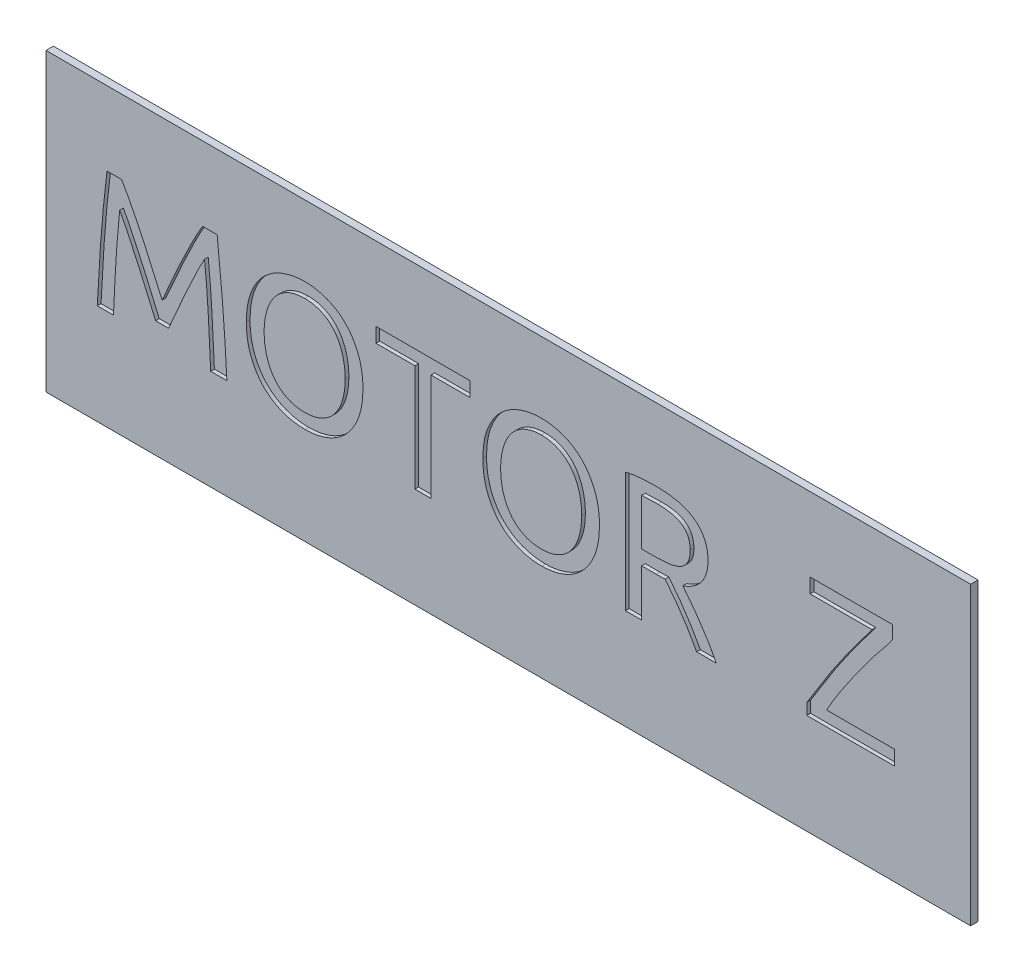
from build123d import *

# Parameters (mm, degrees)
SKETCH1_W           = 25
SKETCH1_H           = 8
BOSS_EXTRUDE1_DEPTH = 0.1
CUT_EXTRUDE7_DEPTH  = 0.1


with BuildPart() as part:
    # Sketch1 → Boss-Extrude1 (new, symmetric)
    with BuildSketch(Plane.XY):
        Rectangle(SKETCH1_W, SKETCH1_H)
    extrude(amount=BOSS_EXTRUDE1_DEPTH, both=True)

    # Sketch9 → Cut-Extrude7 (cut)
    # profile 1 of 6: a face of its own
    with BuildSketch(Plane.XY.offset(0.1)):
        with BuildLine():
            add(Edge.make_bspline(
                [(-9.536229427, -0.848692654), (-9.544634506, -0.828146196), (-9.562600754, -0.784227187), (-9.591985042, -0.714624734), (-9.625492372, -0.637272261), (-9.677233371, -0.521864454), (-9.744504025, -0.364753864), (-9.832482152, -0.166977322), (-9.92296909, 0.042467289), (-10.021780308, 0.254487234), (-10.119578899, 0.464076766), (-10.198456156, 0.633724123), (-10.2570802, 0.763035015), (-10.300618257, 0.852277183), (-10.341354489, 0.937076707), (-10.381804709, 1.015290731), (-10.418106083, 1.08748783), (-10.451534598, 1.150854179), (-10.481216875, 1.205242781), (-10.499607047, 1.238472947), (-10.508061649, 1.253750012)],
                knots=[0, 0, 0, 0, 0.517376005, 1.105915269, 1.760773085, 2.482005002, 4.053536049, 5.743800335, 7.526919201, 9.370646845, 11.19507727, 12.917374885, 13.730991583, 14.503857175, 15.231488722, 15.923435145, 16.555938939, 17.114840553, 17.593061379, 18, 18, 18, 18], degree=3))
            add(Edge.make_bspline(
                [(-10.508061649, 1.253750012), (-10.517836551, 1.1581829), (-10.537795761, 0.963046004), (-10.56460179, 0.664446106), (-10.587458205, 0.353874128), (-10.615737694, -0.076080232), (-10.645384376, -0.624296283), (-10.665130549, -1.065171889), (-10.675052538, -1.286701543)],
                knots=[0, 0, 0, 0, 0.679077711, 1.386597478, 2.119173185, 2.880364868, 4.432456496, 6, 6, 6, 6], degree=3))
            Line((-10.675052538, -1.286701543), (-11.113061427, -1.286701543))
            add(Edge.make_bspline(
                [(-11.113061427, -1.286701543), (-11.105846661, -1.143888281), (-11.091357823, -0.857087801), (-11.068063415, -0.426747336), (-11.039884562, 0.001677469), (-11.008699843, 0.424215727), (-10.973365724, 0.837754975), (-10.942920592, 1.175863444), (-10.916541513, 1.439558233), (-10.89504301, 1.630680777), (-10.873407518, 1.816414483), (-10.857888638, 1.938379771), (-10.850256094, 1.998365123)],
                knots=[0, 0, 0, 0, 1.301379718, 2.613457066, 3.922139659, 5.208762479, 6.46930065, 7.69936116, 8.298256288, 8.881072521, 9.449685557, 10, 10, 10, 10], degree=3))
            Line((-10.850256094, 1.998365123), (-10.456048094, 1.998365123))
            add(Edge.make_bspline(
                [(-10.456048094, 1.998365123), (-10.434443, 1.962186174), (-10.389479226, 1.886891796), (-10.32290253, 1.768078565), (-10.253693047, 1.639775853), (-10.157174908, 1.454764462), (-10.035148563, 1.210829097), (-9.890907706, 0.908338194), (-9.747688832, 0.599707058), (-9.633186619, 0.340946529), (-9.545048714, 0.137473174), (-9.480100574, -0.007045888), (-9.420435846, -0.145839811), (-9.380508701, -0.235520537), (-9.361025871, -0.279281099)],
                knots=[0, 0, 0, 0, 0.59986763, 1.248423783, 1.938655727, 2.675136447, 4.219033946, 5.821264257, 7.445793554, 9.062555474, 9.849353322, 10.602501462, 11.318077322, 12, 12, 12, 12], degree=3))
            add(Edge.make_bspline(
                [(-9.361025871, -0.279281099), (-9.34161754, -0.235487859), (-9.301805976, -0.145656468), (-9.240932219, -0.007393433), (-9.177222037, 0.137670038), (-9.088782171, 0.341012337), (-8.97337299, 0.599361197), (-8.831354593, 0.908539946), (-8.68683726, 1.210798855), (-8.564884499, 1.454767978), (-8.46835739, 1.639775254), (-8.39914953, 1.76807871), (-8.332572447, 1.886891763), (-8.28760872, 1.962186164), (-8.266003649, 1.998365123)],
                knots=[0, 0, 0, 0, 0.681925378, 1.39880734, 2.15064792, 2.937448884, 4.55553772, 6.178712694, 7.780949348, 9.324852961, 10.061336597, 10.751571274, 11.400129995, 12, 12, 12, 12], degree=3))
            Line((-8.266003649, 1.998365123), (-7.871795649, 1.998365123))
            add(Edge.make_bspline(
                [(-7.871795649, 1.998365123), (-7.843560988, 1.731537202), (-7.786649996, 1.19370741), (-7.716444512, 0.379099337), (-7.655476094, -0.449049157), (-7.624565254, -1.006048306), (-7.608990316, -1.286701543)],
                knots=[0, 0, 0, 0, 0.976863678, 1.969008288, 2.976651223, 4, 4, 4, 4], degree=3))
            Line((-7.608990316, -1.286701543), (-8.046999205, -1.286701543))
            add(Edge.make_bspline(
                [(-8.046999205, -1.286701543), (-8.056841874, -1.065166427), (-8.076430189, -0.62427995), (-8.107052119, -0.076145834), (-8.133354769, 0.353947245), (-8.15804529, 0.664359554), (-8.183098502, 0.963132456), (-8.203833148, 1.158196934), (-8.213990094, 1.253750012)],
                knots=[0, 0, 0, 0, 1.567533194, 3.119614613, 3.880697082, 4.61339043, 5.32076402, 6, 6, 6, 6], degree=3))
            add(Edge.make_bspline(
                [(-8.213990094, 1.253750012), (-8.222441922, 1.238471527), (-8.240826061, 1.205238271), (-8.270562721, 1.150877519), (-8.303780327, 1.087285968), (-8.341242626, 1.015681602), (-8.380452545, 0.9368381), (-8.421561881, 0.852340199), (-8.464797458, 0.762847465), (-8.524770688, 0.634163215), (-8.602075337, 0.463788101), (-8.700473372, 0.25457875), (-8.798771229, 0.042228836), (-8.890738682, -0.166563596), (-8.97693876, -0.365220651), (-9.04603685, -0.521429833), (-9.096406201, -0.637439812), (-9.130109986, -0.714605718), (-9.159442103, -0.784231091), (-9.177414404, -0.828147441), (-9.185822316, -0.848692654)],
                knots=[0, 0, 0, 0, 0.406937411, 0.885156816, 1.44405677, 2.078989805, 2.768540071, 3.496169455, 4.269032751, 5.084884979, 6.80495202, 8.629377023, 10.473099188, 12.25835962, 13.946485164, 15.520141682, 16.239232148, 16.894088018, 17.482625532, 18, 18, 18, 18], degree=3))
            Line((-9.185822316, -0.848692654), (-9.536229427, -0.848692654))
        make_face()
    # profile 2 of 6: a face of its own
    with BuildSketch(Plane.XY.offset(0.1)):
        with BuildLine():
            add(Edge.make_bspline(
                [(-7.083379649, 0.35583179), (-7.083011897, 0.390746436), (-7.082285424, 0.45971835), (-7.075730256, 0.561512543), (-7.066517975, 0.660201509), (-7.052707115, 0.755651788), (-7.035112001, 0.847972821), (-7.013018738, 0.936950646), (-6.98782377, 1.022948541), (-6.948889088, 1.132196439), (-6.891703894, 1.260917551), (-6.811648559, 1.404183591), (-6.720116984, 1.533997609), (-6.617215008, 1.650110873), (-6.503547702, 1.752249964), (-6.38155852, 1.842043482), (-6.249603257, 1.916746299), (-6.109964172, 1.978421801), (-5.963244128, 2.025891905), (-5.811771602, 2.061106688), (-5.655648602, 2.082066644), (-5.550182896, 2.084658887), (-5.496966205, 2.085966901)],
                knots=[0, 0, 0, 0, 0.792570647, 1.565678649, 2.315000585, 3.042323967, 3.754365743, 4.447760496, 5.122927003, 5.788006273, 7.079540449, 8.315548746, 9.508262372, 10.678590765, 11.830029448, 12.971618296, 14.110595966, 15.26540766, 16.431545614, 17.60623219, 18.792134379, 20, 20, 20, 20], degree=3))
            add(Edge.make_bspline(
                [(-5.496966205, 2.085966901), (-5.444432174, 2.084668494), (-5.340552633, 2.082101053), (-5.186928069, 2.061101455), (-5.038181188, 2.02589764), (-4.893999699, 1.978299714), (-4.75649071, 1.916542045), (-4.626080546, 1.842253951), (-4.506065786, 1.751960585), (-4.393693829, 1.650154454), (-4.292392792, 1.533525714), (-4.200618876, 1.404415327), (-4.121432489, 1.260850985), (-4.064810252, 1.132118459), (-4.026140495, 1.022825964), (-3.999862162, 0.937083034), (-3.978047432, 0.847953669), (-3.96037041, 0.755657096), (-3.946582283, 0.660200028), (-3.937363657, 0.561512956), (-3.930810236, 0.459718242), (-3.930083523, 0.390746399), (-3.929715649, 0.35583179)],
                knots=[0, 0, 0, 0, 1.200098081, 2.373045331, 3.535064534, 4.688987579, 5.837020001, 6.974362863, 8.110785483, 9.261997156, 10.43304313, 11.633514769, 12.875015323, 14.172847705, 14.842252987, 15.523309022, 16.221213965, 16.93788722, 17.669941481, 18.424137386, 19.202274073, 20, 20, 20, 20], degree=3))
            add(Edge.make_bspline(
                [(-3.929715649, 0.35583179), (-3.930083485, 0.32091717), (-3.930810123, 0.251945305), (-3.937364088, 0.150150752), (-3.946580741, 0.051463094), (-3.960375937, -0.043991874), (-3.978027489, -0.136296013), (-3.9999859, -0.225610319), (-4.026013951, -0.311655807), (-4.064726976, -0.420952939), (-4.12161308, -0.549334492), (-4.200599281, -0.692759867), (-4.292395693, -0.821863778), (-4.393700782, -0.938476979), (-4.506035857, -1.040349745), (-4.626283645, -1.130464317), (-4.756274512, -1.205718539), (-4.89404349, -1.267207357), (-5.038069009, -1.315152517), (-5.187036831, -1.349203779), (-5.340537828, -1.370499649), (-5.444427201, -1.373025796), (-5.496966205, -1.374303321)],
                knots=[0, 0, 0, 0, 0.797660173, 1.57573272, 2.329866459, 3.061860379, 3.778474561, 4.476321977, 5.162310661, 5.831660765, 7.124614354, 8.366012575, 9.566385262, 10.73733471, 11.888451492, 13.024780439, 14.164642593, 15.312580385, 16.466408316, 17.627150272, 18.800000839, 20, 20, 20, 20], degree=3))
            add(Edge.make_bspline(
                [(-5.496966205, -1.374303321), (-5.550187762, -1.373016106), (-5.655663113, -1.370465084), (-5.811664559, -1.349208113), (-5.963354698, -1.315147956), (-6.109920528, -1.267328839), (-6.2498187, -1.205925396), (-6.381355931, -1.130251058), (-6.503577167, -1.040639203), (-6.617209048, -0.938433741), (-6.720110567, -0.822334301), (-6.811681499, -0.692533294), (-6.891469652, -0.549379712), (-6.961428082, -0.393744201), (-7.015655118, -0.224054275), (-7.055449307, -0.041965776), (-7.078627009, 0.152884316), (-7.081764797, 0.286874292), (-7.083379649, 0.35583179)],
                knots=[0, 0, 0, 0, 0.966294476, 1.915018171, 2.853846361, 3.786758636, 4.710609883, 5.623854635, 6.537127584, 7.458280418, 8.39454505, 9.348717906, 10.33752657, 11.366969081, 12.442722914, 13.566707643, 14.747714126, 16, 16, 16, 16], degree=3))
        make_face()
        with BuildLine():
            add(Edge.make_bspline(
                [(-6.601569871, 0.35583179), (-6.600687434, 0.306291997), (-6.598959344, 0.209277484), (-6.58435282, 0.067435613), (-6.560497796, -0.06757804), (-6.52714936, -0.195322759), (-6.484972211, -0.31515596), (-6.434238344, -0.425763365), (-6.375841597, -0.527228262), (-6.30958327, -0.61940614), (-6.234366945, -0.701545918), (-6.151141077, -0.773402993), (-6.060937562, -0.83654569), (-5.962556004, -0.888632829), (-5.856901483, -0.929677345), (-5.744684456, -0.959253532), (-5.626157695, -0.976367967), (-5.545156639, -0.978835687), (-5.503810094, -0.980095321)],
                knots=[0, 0, 0, 0, 1.219915151, 2.388977954, 3.50768494, 4.593874435, 5.637052367, 6.63265979, 7.586765503, 8.516249197, 9.422985944, 10.323153062, 11.219383466, 12.129300506, 13.057951657, 14.005149726, 14.981739616, 16, 16, 16, 16], degree=3))
            add(Edge.make_bspline(
                [(-5.503810094, -0.980095321), (-5.462463404, -0.978841305), (-5.381687831, -0.976391439), (-5.263822077, -0.959331415), (-5.152736215, -0.929691503), (-5.048309556, -0.888464802), (-4.950756451, -0.836557457), (-4.861274892, -0.773368898), (-4.778633249, -0.701582899), (-4.704290373, -0.618965129), (-4.637124481, -0.527492397), (-4.578912531, -0.42572156), (-4.528107143, -0.315167953), (-4.485950489, -0.195319336), (-4.452596223, -0.067579003), (-4.428742841, 0.067435886), (-4.414135858, 0.209277411), (-4.412407832, 0.306291972), (-4.411525427, 0.35583179)],
                knots=[0, 0, 0, 0, 1.020887007, 1.994421647, 2.933173523, 3.853731272, 4.761024907, 5.65494637, 6.553188372, 7.458468617, 8.393664282, 9.35023113, 10.348406742, 11.394275573, 12.483266916, 13.604859629, 14.776938053, 16, 16, 16, 16], degree=3))
            add(Edge.make_bspline(
                [(-4.411525427, 0.35583179), (-4.412407805, 0.405371629), (-4.414135777, 0.502386231), (-4.428743142, 0.644227466), (-4.45259516, 0.77924339), (-4.48595427, 0.906980046), (-4.528093897, 1.026841588), (-4.578958705, 1.137350092), (-4.636870275, 1.239119584), (-4.704748511, 1.330030333), (-4.778390898, 1.413214951), (-4.861093503, 1.485090211), (-4.950982083, 1.547424335), (-5.048264275, 1.599547234), (-5.152861656, 1.640451554), (-5.263696011, 1.671229269), (-5.381705795, 1.687989934), (-5.462469486, 1.69048285), (-5.503810094, 1.691758901)],
                knots=[0, 0, 0, 0, 1.22322333, 2.395456409, 3.517197116, 4.606332151, 5.652338984, 6.650646306, 7.607339372, 8.538116746, 9.447696349, 10.346056874, 11.236877336, 12.144290688, 13.064969904, 14.00531519, 14.978978287, 16, 16, 16, 16], degree=3))
            add(Edge.make_bspline(
                [(-5.503810094, 1.691758901), (-5.545150717, 1.690477553), (-5.626140172, 1.687967294), (-5.744808789, 1.671150569), (-5.856777131, 1.64043616), (-5.962601128, 1.599715525), (-6.060712769, 1.547411268), (-6.151321628, 1.485125449), (-6.23460966, 1.413179835), (-6.309125615, 1.330471525), (-6.376096166, 1.23885425), (-6.434192204, 1.137392108), (-6.484985448, 1.026829534), (-6.527145582, 0.906983487), (-6.560498858, 0.779242423), (-6.584352519, 0.64422774), (-6.598959424, 0.502386157), (-6.600687461, 0.405371604), (-6.601569871, 0.35583179)],
                knots=[0, 0, 0, 0, 1.018396545, 1.995117023, 2.943890731, 3.87266606, 4.782704772, 5.675860912, 6.576148398, 7.487158225, 8.412220005, 9.3664533, 10.362193854, 11.405511279, 12.491846017, 13.610702595, 14.779921723, 16, 16, 16, 16], degree=3))
        make_face(mode=Mode.SUBTRACT)
    # profile 3 of 6: a face of its own
    with BuildSketch(Plane.XY.offset(0.1)):
        Polygon((-1.038856983, 1.998365123), (-1.038856983, 1.604157123), (-2.090078316, 1.604157123), (-2.090078316, -1.286701543), (-2.528087205, -1.286701543), (-2.528087205, 1.604157123), (-3.579308538, 1.604157123), (-3.579308538, 1.998365123), align=None)
    # profile 4 of 6: a face of its own
    with BuildSketch(Plane.XY.offset(0.1)):
        with BuildLine():
            add(Edge.make_bspline(
                [(-0.688449871, 0.35583179), (-0.68808212, 0.390746436), (-0.687355646, 0.45971835), (-0.680800478, 0.561512543), (-0.671588197, 0.660201509), (-0.657777337, 0.755651788), (-0.640182224, 0.847972821), (-0.61808896, 0.936950646), (-0.592893992, 1.022948541), (-0.553959311, 1.132196439), (-0.496774116, 1.260917551), (-0.416718781, 1.404183591), (-0.325187206, 1.533997609), (-0.22228523, 1.650110873), (-0.108617925, 1.752249964), (0.013371258, 1.842043482), (0.145326521, 1.916746299), (0.284965605, 1.978421801), (0.431685649, 2.025891905), (0.583158176, 2.061106688), (0.739281175, 2.082066644), (0.844746882, 2.084658887), (0.897963573, 2.085966901)],
                knots=[0, 0, 0, 0, 0.792570647, 1.565678649, 2.315000585, 3.042323967, 3.754365743, 4.447760496, 5.122927003, 5.788006273, 7.079540449, 8.315548746, 9.508262372, 10.678590765, 11.830029448, 12.971618296, 14.110595966, 15.26540766, 16.431545614, 17.60623219, 18.792134379, 20, 20, 20, 20], degree=3))
            add(Edge.make_bspline(
                [(0.897963573, 2.085966901), (0.950497604, 2.084668494), (1.054377145, 2.082101053), (1.208001708, 2.061101455), (1.35674859, 2.02589764), (1.500930079, 1.978299714), (1.638439068, 1.916542045), (1.768849232, 1.842253951), (1.888863992, 1.751960585), (2.001235949, 1.650154454), (2.102536986, 1.533525714), (2.194310902, 1.404415327), (2.273497289, 1.260850985), (2.330119526, 1.132118459), (2.368789283, 1.022825964), (2.395067616, 0.937083034), (2.416882345, 0.847953669), (2.434559368, 0.755657096), (2.448347494, 0.660200028), (2.45756612, 0.561512956), (2.464119542, 0.459718242), (2.464846255, 0.390746399), (2.465214129, 0.35583179)],
                knots=[0, 0, 0, 0, 1.200098081, 2.373045331, 3.535064534, 4.688987579, 5.837020001, 6.974362863, 8.110785483, 9.261997156, 10.43304313, 11.633514769, 12.875015323, 14.172847705, 14.842252987, 15.523309022, 16.221213965, 16.93788722, 17.669941481, 18.424137386, 19.202274073, 20, 20, 20, 20], degree=3))
            add(Edge.make_bspline(
                [(2.465214129, 0.35583179), (2.464846293, 0.32091717), (2.464119655, 0.251945305), (2.457565689, 0.150150752), (2.448349037, 0.051463094), (2.434553841, -0.043991874), (2.416902289, -0.136296013), (2.394943878, -0.225610319), (2.368915827, -0.311655807), (2.330202802, -0.420952939), (2.273316697, -0.549334492), (2.194330496, -0.692759867), (2.102534085, -0.821863778), (2.001228995, -0.938476979), (1.888893921, -1.040349745), (1.768646133, -1.130464317), (1.638655265, -1.205718539), (1.500886288, -1.267207357), (1.356860769, -1.315152517), (1.207892946, -1.349203779), (1.05439195, -1.370499649), (0.950502577, -1.373025796), (0.897963573, -1.374303321)],
                knots=[0, 0, 0, 0, 0.797660173, 1.57573272, 2.329866459, 3.061860379, 3.778474561, 4.476321977, 5.162310661, 5.831660765, 7.124614354, 8.366012575, 9.566385262, 10.73733471, 11.888451492, 13.024780439, 14.164642593, 15.312580385, 16.466408316, 17.627150272, 18.800000839, 20, 20, 20, 20], degree=3))
            add(Edge.make_bspline(
                [(0.897963573, -1.374303321), (0.844742016, -1.373016106), (0.739266665, -1.370465084), (0.583265218, -1.349208113), (0.43157508, -1.315147956), (0.28500925, -1.267328839), (0.145111078, -1.205925396), (0.013573847, -1.130251058), (-0.108647389, -1.040639203), (-0.22227927, -0.938433741), (-0.325180789, -0.822334301), (-0.416751721, -0.692533294), (-0.496539875, -0.549379712), (-0.566498305, -0.393744201), (-0.62072534, -0.224054275), (-0.66051953, -0.041965776), (-0.683697231, 0.152884316), (-0.686835019, 0.286874292), (-0.688449871, 0.35583179)],
                knots=[0, 0, 0, 0, 0.966294476, 1.915018171, 2.853846361, 3.786758636, 4.710609883, 5.623854635, 6.537127584, 7.458280418, 8.39454505, 9.348717906, 10.33752657, 11.366969081, 12.442722914, 13.566707643, 14.747714126, 16, 16, 16, 16], degree=3))
        make_face()
        with BuildLine():
            add(Edge.make_bspline(
                [(-0.206640094, 0.35583179), (-0.205757656, 0.306291997), (-0.204029566, 0.209277484), (-0.189423042, 0.067435613), (-0.165568019, -0.06757804), (-0.132219583, -0.195322759), (-0.090042434, -0.31515596), (-0.039308566, -0.425763365), (0.019088181, -0.527228262), (0.085346508, -0.61940614), (0.160562833, -0.701545918), (0.243788701, -0.773402993), (0.333992216, -0.83654569), (0.432373774, -0.888632829), (0.538028295, -0.929677345), (0.650245322, -0.959253532), (0.768772083, -0.976367967), (0.849773139, -0.978835687), (0.891119684, -0.980095321)],
                knots=[0, 0, 0, 0, 1.219915151, 2.388977954, 3.50768494, 4.593874435, 5.637052367, 6.63265979, 7.586765503, 8.516249197, 9.422985944, 10.323153062, 11.219383466, 12.129300506, 13.057951657, 14.005149726, 14.981739616, 16, 16, 16, 16], degree=3))
            add(Edge.make_bspline(
                [(0.891119684, -0.980095321), (0.932466374, -0.978841305), (1.013241947, -0.976391439), (1.131107701, -0.959331415), (1.242193563, -0.929691503), (1.346620222, -0.888464802), (1.444173327, -0.836557457), (1.533654885, -0.773368898), (1.616296529, -0.701582899), (1.690639405, -0.618965129), (1.757805296, -0.527492397), (1.816017246, -0.42572156), (1.866822634, -0.315167953), (1.908979289, -0.195319336), (1.942333555, -0.067579003), (1.966186937, 0.067435886), (1.98079392, 0.209277411), (1.982521946, 0.306291972), (1.983404351, 0.35583179)],
                knots=[0, 0, 0, 0, 1.020887007, 1.994421647, 2.933173523, 3.853731272, 4.761024907, 5.65494637, 6.553188372, 7.458468617, 8.393664282, 9.35023113, 10.348406742, 11.394275573, 12.483266916, 13.604859629, 14.776938053, 16, 16, 16, 16], degree=3))
            add(Edge.make_bspline(
                [(1.983404351, 0.35583179), (1.982521973, 0.405371629), (1.980794, 0.502386231), (1.966186636, 0.644227466), (1.942334618, 0.77924339), (1.908975507, 0.906980046), (1.866835881, 1.026841588), (1.815971073, 1.137350092), (1.758059502, 1.239119584), (1.690181267, 1.330030333), (1.61653888, 1.413214951), (1.533836275, 1.485090211), (1.443947695, 1.547424335), (1.346665502, 1.599547234), (1.242068122, 1.640451554), (1.131233767, 1.671229269), (1.013223983, 1.687989934), (0.932460292, 1.69048285), (0.891119684, 1.691758901)],
                knots=[0, 0, 0, 0, 1.22322333, 2.395456409, 3.517197116, 4.606332151, 5.652338984, 6.650646306, 7.607339372, 8.538116746, 9.447696349, 10.346056874, 11.236877336, 12.144290688, 13.064969904, 14.00531519, 14.978978287, 16, 16, 16, 16], degree=3))
            add(Edge.make_bspline(
                [(0.891119684, 1.691758901), (0.849779061, 1.690477553), (0.768789606, 1.687967294), (0.650120988, 1.671150569), (0.538152647, 1.64043616), (0.432328649, 1.599715525), (0.334217009, 1.547411268), (0.24360815, 1.485125449), (0.160320117, 1.413179835), (0.085804163, 1.330471525), (0.018833612, 1.23885425), (-0.039262426, 1.137392108), (-0.09005567, 1.026829534), (-0.132215804, 0.906983487), (-0.165569081, 0.779242423), (-0.189422741, 0.64422774), (-0.204029646, 0.502386157), (-0.205757683, 0.405371604), (-0.206640094, 0.35583179)],
                knots=[0, 0, 0, 0, 1.018396545, 1.995117023, 2.943890731, 3.87266606, 4.782704772, 5.675860912, 6.576148398, 7.487158225, 8.412220005, 9.3664533, 10.362193854, 11.405511279, 12.491846017, 13.610702595, 14.779921723, 16, 16, 16, 16], degree=3))
        make_face(mode=Mode.SUBTRACT)
    # profile 5 of 6: a face of its own
    with BuildSketch(Plane.XY.offset(0.1)):
        with BuildLine():
            add(Edge.make_bspline(
                [(4.71890674, 0.073179179), (4.732578358, 0.056284791), (4.761759345, 0.020225057), (4.808776028, -0.037158654), (4.859479242, -0.103082007), (4.937201559, -0.201362865), (5.039285765, -0.336845972), (5.161733581, -0.513146595), (5.286087021, -0.701424986), (5.408117265, -0.895986243), (5.522606249, -1.090165181), (5.587496118, -1.222636043), (5.618878129, -1.286701543)],
                knots=[0, 0, 0, 0, 0.39895293, 0.851533429, 1.361692953, 1.925477831, 3.151634299, 4.474851238, 5.865126127, 7.293134198, 8.690906733, 10, 10, 10, 10], degree=3))
            Line((5.618878129, -1.286701543), (5.093267462, -1.286701543))
            add(Edge.make_bspline(
                [(5.093267462, -1.286701543), (5.06081494, -1.226706554), (4.994982575, -1.105002235), (4.888300918, -0.925671017), (4.779262584, -0.748005634), (4.667000407, -0.578032349), (4.555072192, -0.417286608), (4.461286479, -0.290781405), (4.388064805, -0.196057679), (4.337685935, -0.129605077), (4.28827774, -0.069334895), (4.256481851, -0.03039597), (4.241203295, -0.011685043)],
                knots=[0, 0, 0, 0, 1.332032401, 2.702127276, 4.074589059, 5.403017504, 6.679814136, 7.899745713, 8.478100808, 9.01815218, 9.52820262, 10, 10, 10, 10], degree=3))
            add(Edge.make_bspline(
                [(4.241203295, -0.011685043), (4.221363014, -0.012977492), (4.18148229, -0.015575428), (4.120982563, -0.016722747), (4.059384395, -0.016411833), (4.017864527, -0.016454299), (3.996876462, -0.016475765)],
                knots=[0, 0, 0, 0, 0.975943851, 1.961733701, 2.969667585, 4, 4, 4, 4], degree=3))
            Line((3.996876462, -0.016475765), (3.60403724, -0.016475765))
            Line((3.60403724, -0.016475765), (3.60403724, -1.286701543))
            Line((3.60403724, -1.286701543), (3.166028351, -1.286701543))
            Line((3.166028351, -1.286701543), (3.166028351, 1.962092512))
            add(Edge.make_bspline(
                [(3.166028351, 1.962092512), (3.19858171, 1.969723115), (3.264954686, 1.985281136), (3.368253595, 2.002852309), (3.476760992, 2.01629468), (3.589107057, 2.026136458), (3.701605383, 2.033705582), (3.811161956, 2.037992407), (3.915632387, 2.042103284), (3.983640976, 2.042145484), (4.01672374, 2.042166012)],
                knots=[0, 0, 0, 0, 0.936858455, 1.910158761, 2.934709766, 4.000327786, 5.07032876, 6.094241242, 7.072944044, 8, 8, 8, 8], degree=3))
            add(Edge.make_bspline(
                [(4.01672374, 2.042166012), (4.071270037, 2.041419458), (4.177315288, 2.039968058), (4.331374542, 2.027578799), (4.475619855, 2.007177556), (4.609968465, 1.97918829), (4.733742562, 1.940940968), (4.848183521, 1.896527987), (4.951870318, 1.841809244), (5.046329448, 1.780593907), (5.130117876, 1.710325997), (5.202198276, 1.631090577), (5.263780651, 1.54409121), (5.314232149, 1.448963564), (5.352085842, 1.345362511), (5.380615834, 1.234282527), (5.396854052, 1.114843007), (5.39884958, 1.032512362), (5.399873684, 0.99026029)],
                knots=[0, 0, 0, 0, 1.323601272, 2.573256743, 3.747691024, 4.857446838, 5.899470048, 6.888477296, 7.831963868, 8.739467171, 9.61562628, 10.477767351, 11.331817884, 12.196142649, 13.082579076, 14.002377664, 14.974820596, 16, 16, 16, 16], degree=3))
            add(Edge.make_bspline(
                [(5.399873684, 0.99026029), (5.399394894, 0.963086664), (5.398455158, 0.909752111), (5.389659625, 0.831388956), (5.377288586, 0.755684977), (5.357655999, 0.683351308), (5.334054115, 0.613443348), (5.303416748, 0.547202955), (5.268790931, 0.483249626), (5.22819365, 0.422787978), (5.182089712, 0.366063848), (5.13152097, 0.312231513), (5.074904308, 0.263148443), (5.014067469, 0.217062706), (4.947762845, 0.175243054), (4.876543308, 0.136789086), (4.799732728, 0.102683923), (4.746175255, 0.083133286), (4.71890674, 0.073179179)],
                knots=[0, 0, 0, 0, 1.060243578, 2.080974247, 3.074982359, 4.051242852, 5.003075487, 5.951528304, 6.896001729, 7.839425154, 8.789256386, 9.746654126, 10.718355673, 11.710327577, 12.723142916, 13.7749394, 14.867121724, 16, 16, 16, 16], degree=3))
        make_face()
        with BuildLine():
            add(Edge.make_bspline(
                [(4.043414906, 1.647958012), (3.998471729, 1.647897494), (3.914050644, 1.647783815), (3.795852153, 1.645140069), (3.694296586, 1.640587105), (3.632316212, 1.635779396), (3.60403724, 1.633585846)],
                knots=[0, 0, 0, 0, 1.226397817, 2.303660725, 3.226033522, 4, 4, 4, 4], degree=3))
            Line((3.60403724, 1.633585846), (3.60403724, 0.377732235))
            Line((3.60403724, 0.377732235), (3.922962462, 0.377732235))
            add(Edge.make_bspline(
                [(3.922962462, 0.377732235), (3.960609987, 0.377918754), (4.034112657, 0.378282914), (4.141372176, 0.383320363), (4.242719201, 0.390720346), (4.337988751, 0.400756348), (4.427013645, 0.414205117), (4.508771417, 0.435198669), (4.583680389, 0.460068832), (4.651791862, 0.490832899), (4.712227572, 0.528660995), (4.766108762, 0.57270049), (4.81116047, 0.624856186), (4.850585944, 0.683188785), (4.881784401, 0.750704674), (4.903107759, 0.828109825), (4.916172895, 0.914989617), (4.917413927, 0.976066123), (4.918063906, 1.008054401)],
                knots=[0, 0, 0, 0, 1.331103828, 2.598834446, 3.795999538, 4.923781214, 5.986046906, 6.976019087, 7.904566374, 8.774462249, 9.611574649, 10.419252693, 11.225156327, 12.039533879, 12.902105529, 13.841729319, 14.869624859, 16, 16, 16, 16], degree=3))
            add(Edge.make_bspline(
                [(4.918063906, 1.008054401), (4.917399476, 1.037993336), (4.916119471, 1.095669806), (4.902895449, 1.178410621), (4.881523605, 1.253731092), (4.849963729, 1.320730668), (4.812226113, 1.380730905), (4.768088227, 1.433935223), (4.717726806, 1.480310772), (4.660834696, 1.519256731), (4.599063268, 1.552793404), (4.532138783, 1.580993995), (4.459934775, 1.603599691), (4.355242249, 1.625923644), (4.2158395, 1.644567741), (4.101884831, 1.646808357), (4.043414906, 1.647958012)],
                knots=[0, 0, 0, 0, 1.015413047, 1.956163169, 2.835783782, 3.663755472, 4.460733554, 5.23601356, 6.003247679, 6.77651437, 7.569986583, 8.385408099, 9.237644693, 10.133775775, 12.016247684, 14, 14, 14, 14], degree=3))
        make_face(mode=Mode.SUBTRACT)
    # profile 6 of 6: a face of its own
    with BuildSketch(Plane.XY.offset(0.1)):
        with BuildLine():
            add(Edge.make_bspline(
                [(10.393175017, 1.647958012), (10.374797112, 1.622333631), (10.336953779, 1.569568529), (10.276877849, 1.48998698), (10.21248914, 1.407281429), (10.142324331, 1.323211405), (10.069592451, 1.234623457), (9.994462591, 1.142010295), (9.917530433, 1.044222254), (9.810761279, 0.906264677), (9.67459796, 0.724400022), (9.508446322, 0.498916919), (9.342241797, 0.265890833), (9.178099471, 0.030058078), (9.020496757, -0.206834232), (8.871034696, -0.441014971), (8.73232404, -0.668613545), (8.647353053, -0.819486287), (8.606235629, -0.892493543)],
                knots=[0, 0, 0, 0, 0.486714395, 1.002230399, 1.538991894, 2.104374088, 2.692301471, 3.308233795, 3.945069881, 4.612777537, 6.000868073, 7.451704174, 8.935973151, 10.418746027, 11.886617637, 13.327441272, 14.706749966, 16, 16, 16, 16], degree=3))
            Line((8.606235629, -0.892493543), (10.436975906, -0.892493543))
            Line((10.436975906, -0.892493543), (10.436975906, -1.286701543))
            Line((10.436975906, -1.286701543), (8.071727906, -1.286701543))
            Line((8.071727906, -1.286701543), (8.071727906, -0.980095321))
            add(Edge.make_bspline(
                [(8.071727906, -0.980095321), (8.091192773, -0.950943506), (8.131460012, -0.890636746), (8.192610785, -0.795871128), (8.255969703, -0.693609563), (8.344156552, -0.545487824), (8.45974452, -0.352911839), (8.607705854, -0.11856261), (8.763223891, 0.119156269), (8.923841507, 0.358026977), (9.086464236, 0.593445275), (9.248838706, 0.820745104), (9.408038587, 1.035950392), (9.538968728, 1.20621119), (9.640287483, 1.334595106), (9.709144444, 1.427547354), (9.774665515, 1.516232634), (9.815470455, 1.575307267), (9.835398073, 1.604157123)],
                knots=[0, 0, 0, 0, 0.537401585, 1.111730074, 1.729010068, 2.381613847, 3.754607445, 5.172311355, 6.630340788, 8.109659246, 9.585301653, 11.016864208, 12.392114501, 13.689086042, 14.30964694, 14.899329146, 15.462473235, 16, 16, 16, 16], degree=3))
            Line((9.835398073, 1.604157123), (8.159329684, 1.604157123))
            Line((8.159329684, 1.604157123), (8.159329684, 1.998365123))
            Line((8.159329684, 1.998365123), (10.393175017, 1.998365123))
            Line((10.393175017, 1.998365123), (10.393175017, 1.647958012))
        make_face()
    extrude(amount=-CUT_EXTRUDE7_DEPTH, mode=Mode.SUBTRACT)


solid = part.part
